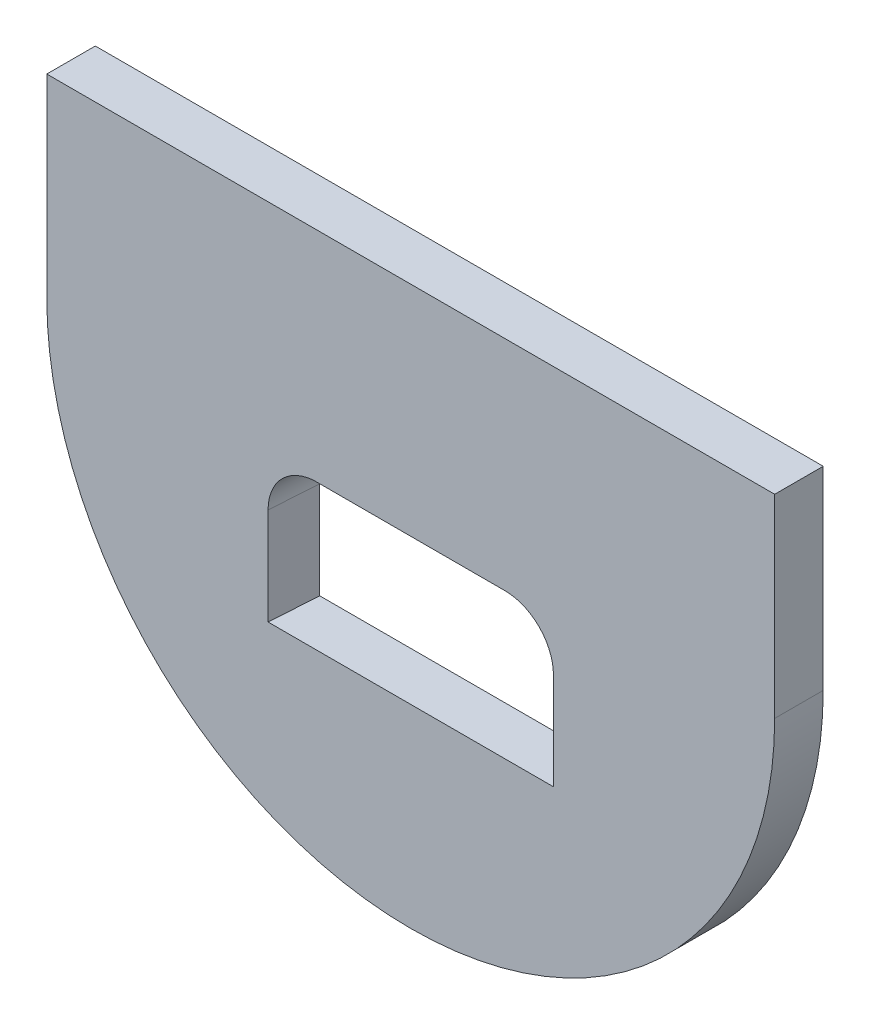
from build123d import *
from OCP.BRepFilletAPI import BRepFilletAPI_MakeChamfer

# Parameters (mm, degrees)
SKETCH1_W           = 57.5
SKETCH1_H           = 30
BOSS_EXTRUDE1_DEPTH = 10
CHAMFER1_SIZE       = 10
CHAMFER1_SIZE_2     = 0.648423639
FILLET1_R           = 10


# Some blends are built 0.0001 mm under size
with BuildPart() as part:
    # Sketch1 → Boss-Extrude1 (new body)
    with BuildSketch(Plane.XY):
        with BuildLine():
            Line((0, -40), (0, 0))
            Line((0, 0), (-150, 0))
            Line((-150, 0), (-150, -40))
            ThreePointArc((-150, -40), (-75, -115), (0, -40))
        make_face()
        with Locations((-75, -60)):
            Rectangle(SKETCH1_W, SKETCH1_H, mode=Mode.SUBTRACT)
    extrude(amount=BOSS_EXTRUDE1_DEPTH)

    # Chamfer1
    chamfer1_edges_1 = [part.edges().sort_by_distance(p)[0] for p in [
        (-46.25, -60, 10),
    ]]
    chamfer1_side_1 = [part.faces().sort_by_distance(p)[0] for p in [
        (-46.25, -60, 9.987031527),
    ]]
    chamfer1_edges_2 = [part.edges().sort_by_distance(p)[0] for p in [
        (-103.75, -60, 10),
    ]]
    chamfer1_side_2 = [part.faces().sort_by_distance(p)[0] for p in [
        (-103.75, -60, 9.987031527),
    ]]
    chamfer1 = BRepFilletAPI_MakeChamfer(part.part.solid().wrapped)
    for e in chamfer1_edges_1:
        chamfer1.Add(CHAMFER1_SIZE - 0.0001, CHAMFER1_SIZE_2 - 0.0001, e.wrapped, chamfer1_side_1[0].wrapped)
    for e in chamfer1_edges_2:
        chamfer1.Add(CHAMFER1_SIZE - 0.0001, CHAMFER1_SIZE_2 - 0.0001, e.wrapped, chamfer1_side_2[0].wrapped)
    add(Compound.cast(chamfer1.Shape()), mode=Mode.REPLACE)  # a hair under: the kernel refuses the full size

    # Fillet1
    # the kernel refuses this fillet: 10 mm, written as the material it adds along each edge
    with BuildSketch(Plane(origin=(-47.867429584, -45, -24.947523565), x_dir=(-0.9979049426006561, 0, 0.06469718334812755), z_dir=(0.06469718334812756, 0, 0.9979049426006562))) as fillet1_piece_1_section:
        with BuildLine():
            CenterArc((FILLET1_R, FILLET1_R), FILLET1_R, 180, 90)
            Line((0, FILLET1_R), (0, 0))
            Line((0, 0), (FILLET1_R, 0))
        make_face()
    fillet1_piece_1 = extrude(amount=60.020894349, mode=Mode.PRIVATE)
    fillet1_piece_1 = split(fillet1_piece_1, bisect_by=Plane(origin=(-48.707082499, -46.782935943, 10), z_dir=(0, 0, -1)), keep=Keep.TOP, mode=Mode.PRIVATE)
    fillet1_piece_1 = split(fillet1_piece_1, bisect_by=Plane(origin=(-48.707082499, -46.782935943, 0), z_dir=(0, 0, 1)), keep=Keep.TOP, mode=Mode.PRIVATE)
    add(fillet1_piece_1)
    with BuildSketch(Plane(origin=(-102.132570416, -45, -24.947523565), x_dir=(0.9979049426006561, 0, 0.06469718334812756), z_dir=(-0.06469718334812756, 0, 0.9979049426006562))) as fillet1_piece_2_section:
        with BuildLine():
            CenterArc((FILLET1_R, -FILLET1_R), FILLET1_R, 90, 90)
            Line((0, -FILLET1_R), (0, 0))
            Line((0, 0), (FILLET1_R, 0))
        make_face()
    fillet1_piece_2 = extrude(amount=60.020894349, mode=Mode.PRIVATE)
    fillet1_piece_2 = split(fillet1_piece_2, bisect_by=Plane(origin=(-101.292917501, -46.782935943, 10), z_dir=(0, 0, -1)), keep=Keep.TOP, mode=Mode.PRIVATE)
    fillet1_piece_2 = split(fillet1_piece_2, bisect_by=Plane(origin=(-101.292917501, -46.782935943, 0), z_dir=(0, 0, 1)), keep=Keep.TOP, mode=Mode.PRIVATE)
    add(fillet1_piece_2)


solid = part.part
